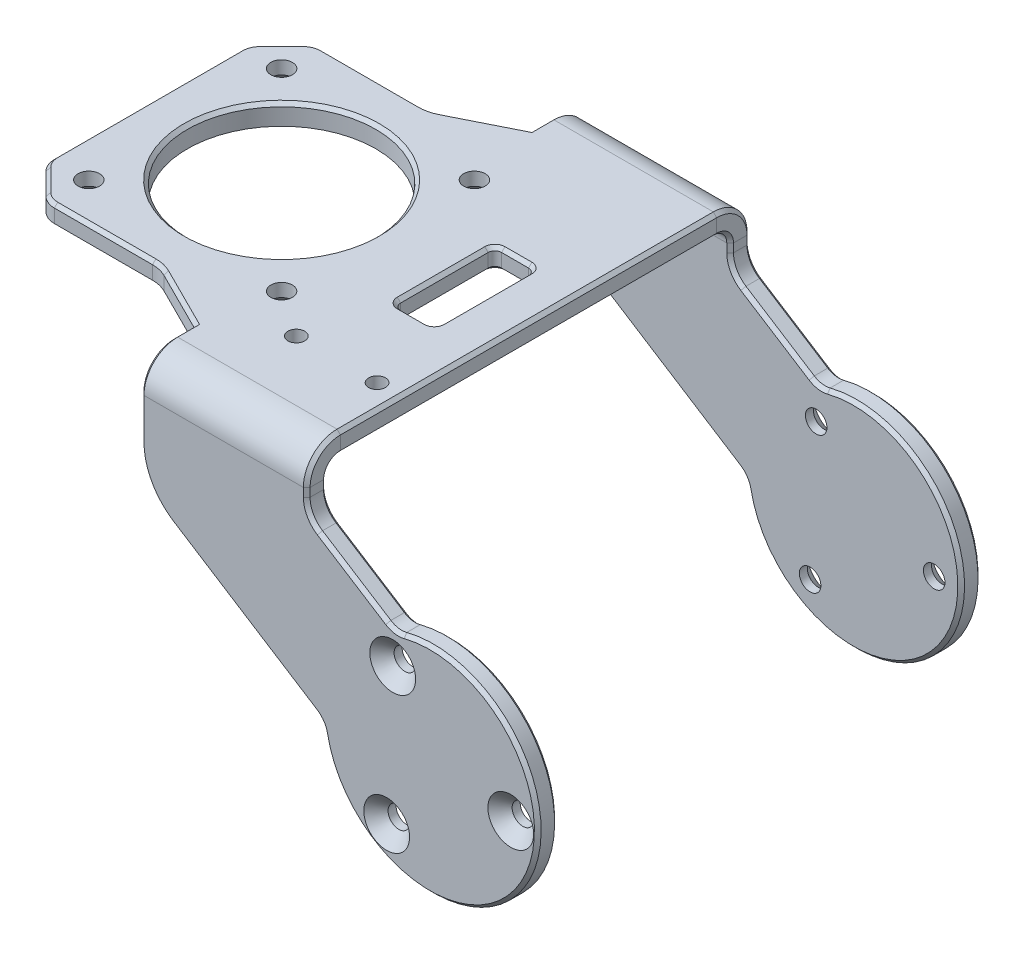
from build123d import *

# Parameters (mm, degrees)
SKETCH_1_R                     = 1.6
SKETCH_1_R_2                   = 14
SKETCH_1_R_3                   = 7
SM_BASE_FLANGE_1_DEPTH         = 3
OTHER_START                    = 32.948163932
OTHER_5_OUTLINE_W              = 24.67856091
OTHER_5_OUTLINE_H              = 3
OTHER_5_DEPTH                  = 29.170252075
OTHER_START_2                  = 29.948163932
OTHER_5_2_OUTLINE_R            = 1.6
OTHER_5_2_OUTLINE_R_2          = 7
OTHER_5_2_DEPTH                = 2.5137
OTHER_START_3                  = 32.631303932
OTHER_5_3_OUTLINE_W            = 24.67856091
OTHER_5_3_OUTLINE_H            = 3
OTHER_5_3_DEPTH                = 0.31686
OTHER_START_4                  = 27.948163932
OTHER_5_4_OUTLINE_R            = 1.6
OTHER_5_4_OUTLINE_R_2          = 7
OTHER_5_4_DEPTH                = 5
OTHER_START_5                  = 12
OTHER_5_5_DEPTH                = 60
OTHER_START_6                  = -62.118416007
OTHER_6_OUTLINE_W              = 24.67856091
OTHER_6_OUTLINE_H              = 3
OTHER_6_DEPTH                  = 29.170252075
OTHER_START_7                  = -32.461863932
OTHER_6_2_OUTLINE_R            = 1.6
OTHER_6_2_OUTLINE_R_2          = 7
OTHER_6_2_DEPTH                = 2.5137
OTHER_START_8                  = -32.948163932
OTHER_6_3_OUTLINE_R            = 1.6
OTHER_6_3_OUTLINE_R_2          = 7
OTHER_6_3_DEPTH                = 5
OTHER_6_4_DEPTH                = 60
OTHER_START_9                  = -3
OTHER_6_5_OUTLINE_R            = 1.6
OTHER_6_5_OUTLINE_R_2          = 7
OTHER_6_5_DEPTH                = 3
CHAMFER_1_SIZE                 = 5
FILLET_1_R                     = 3
SKETCH_14_W                    = 6
SKETCH_14_H                    = 7.5
CUT_EXTRUDE_1_DEPTH            = 10
EXTRUDE_1_DEPTH                = 3
FILLET_5_R                     = 5
SKETCH_16_R                    = 1
CUT_EXTRUDE_2_DEPTH            = 5
HOLE_WIZARD_M3_3_D             = 2.5
HOLE_WIZARD_M3_3_DEPTH         = 3
HOLE_WIZARD_M3_3_TIP           = 0.751075774
FILLET_7_R                     = 4
FILLET_8_R                     = 10
HOLE_WIZARD_M3_2_D             = 3.2
HOLE_WIZARD_M3_2_DEPTH         = 3
HOLE_WIZARD_M3_2_CSINK_D       = 6.8
HOLE_WIZARD_M3_2_CSINK_ANGLE   = 90
HOLE_WIZARD_M3_2_TIP           = 0.96137699
EXTRUDE_START                  = -3
SKETCH_31_R                    = 1.6
SKETCH_31_R_2                  = 1.55
EXTRUDE_2_DEPTH                = 3
FILLET_9_R                     = 3
FILLET_10_R                    = 1
HOLE_WIZARD_M3_3_2_D           = 3.2
HOLE_WIZARD_M3_3_2_DEPTH       = 3
HOLE_WIZARD_M3_3_2_CSINK_D     = 6.8
HOLE_WIZARD_M3_3_2_CSINK_ANGLE = 90
HOLE_WIZARD_M3_3_2_TIP         = 0.96137699
HOLE_WIZARD_M3_4_D             = 3.2
HOLE_WIZARD_M3_4_CSINK_D       = 5.3
HOLE_WIZARD_M3_4_CSINK_ANGLE   = 90
SKETCH_40_R                    = 7
EXTRUDE_3_DEPTH                = 3
SKETCH_41_R                    = 7
EXTRUDE_4_DEPTH                = 3
SKETCH_43_R                    = 17.4
SKETCH_43_R_2                  = 15
CUT_EXTRUDE_4_DEPTH            = 1.9
EXTRUDE_5_DEPTH                = 1.9
FILLET_11_R                    = 1
CHAMFER_4_SIZE                 = 0.5
CHAMFER_5_SIZE                 = 0.5


with BuildPart() as part:
    # 基体-法兰1: sheet metal written as solids
    # Sketch 1 → 基体-法兰1 (new body)
    with BuildSketch(Plane(origin=(0, 0, 0), x_dir=(1, 0, 0), z_dir=(0, 1, 0))):
        with BuildLine():
            Line((12, 20), (-20, 20))
            Line((-20, 20), (-20, -20))
            Line((-20, -20), (12, -20))
            Line((12, -20), (12, -44.485))
            Line((12, -44.485), (39.093770546, -61.729700713))
            ThreePointArc((39.093770546, -61.729700713), (68.497859333, -68.591146222), (49.832703324, -44.857376546))
            Line((49.832703324, -44.857376546), (36.67856091, -36.485))
            Line((36.67856091, -36.485), (36.67856091, 36.485))
            Line((36.67856091, 36.485), (49.832703324, 44.857376546))
            ThreePointArc((49.832703324, 44.857376546), (68.497859333, 68.591146222), (39.093770546, 61.729700713))
            Line((39.093770546, 61.729700713), (12, 44.485))
            Line((12, 44.485), (12, 20))
        make_face()
        with Locations(Location((-14.318912319, -14.318912319, 0), (0, 0, 270))):
            Circle(SKETCH_1_R, mode=Mode.SUBTRACT)
        with Locations(Location((0, 0, 0), (0, 0, 270))):
            Circle(SKETCH_1_R_2, mode=Mode.SUBTRACT)
        with Locations(Location((14.318912319, -14.318912319, 0), (0, 0, 270))):
            Circle(SKETCH_1_R, mode=Mode.SUBTRACT)
        with Locations(Location((48.556640333, -70.1233945, 0), (0, 0, 270))):
            Circle(SKETCH_1_R, mode=Mode.SUBTRACT)
        with Locations(Location((55, -60, 0), (0, 0, 270))):
            Circle(SKETCH_1_R_3, mode=Mode.SUBTRACT)
        with Locations(Location((66.988796643, -60.518415907, 0), (0, 0, 270))):
            Circle(SKETCH_1_R, mode=Mode.SUBTRACT)
        with Locations(Location((49.454563024, -49.358189593, 0), (0, 0, 270))):
            Circle(SKETCH_1_R, mode=Mode.SUBTRACT)
        with Locations(Location((-14.318912319, 14.318912319, 0), (0, 0, 270))):
            Circle(SKETCH_1_R, mode=Mode.SUBTRACT)
        with Locations(Location((14.318912319, 14.318912319, 0), (0, 0, 270))):
            Circle(SKETCH_1_R, mode=Mode.SUBTRACT)
        with Locations(Location((49.454563024, 49.358189593, 0), (0, 0, 90))):
            Circle(SKETCH_1_R, mode=Mode.SUBTRACT)
        with Locations(Location((55, 60, 0), (0, 0, 90))):
            Circle(SKETCH_1_R_3, mode=Mode.SUBTRACT)
        with Locations(Location((48.556640333, 70.1233945, 0), (0, 0, 90))):
            Circle(SKETCH_1_R, mode=Mode.SUBTRACT)
        with Locations(Location((66.988796643, 60.518415907, 0), (0, 0, 90))):
            Circle(SKETCH_1_R, mode=Mode.SUBTRACT)
    extrude(amount=-SM_BASE_FLANGE_1_DEPTH)

    # Other 5: read off the stored shape, not the designer's step
    # Other 5 outline → Other 5 (cut)
    with BuildSketch(Plane.XY.offset(OTHER_START)):
        with Locations((24.339280455, -1.5)):
            Rectangle(OTHER_5_OUTLINE_W, OTHER_5_OUTLINE_H)
    extrude(amount=OTHER_5_DEPTH, mode=Mode.SUBTRACT)

    # Other 5 2 outline → Other 5 2 (add)
    with BuildSketch(Plane.XY.offset(OTHER_START_2)):
        with BuildLine():
            Line((12, -3), (12, -16.463163932))
            Line((12, -16.463163932), (39.093770546, -33.707864645))
            ThreePointArc((39.093770546, -33.707864645), (68.497859333, -40.569310155), (49.832703324, -16.835540479))
            Line((49.832703324, -16.835540479), (36.67856091, -8.463163932))
            Line((36.67856091, -8.463163932), (36.67856091, -3))
            Line((36.67856091, -3), (12, -3))
        make_face()
        with Locations((48.556640333, -42.101558432)):
            Circle(OTHER_5_2_OUTLINE_R, mode=Mode.SUBTRACT)
        with Locations((55, -31.978163932)):
            Circle(OTHER_5_2_OUTLINE_R_2, mode=Mode.SUBTRACT)
        with Locations((66.988796643, -32.496579839)):
            Circle(OTHER_5_2_OUTLINE_R, mode=Mode.SUBTRACT)
        with Locations((49.454563024, -21.336353525)):
            Circle(OTHER_5_2_OUTLINE_R, mode=Mode.SUBTRACT)
    extrude(amount=OTHER_5_2_DEPTH)

    # Other 5 3 outline → Other 5 3 (cut)
    with BuildSketch(Plane.XY.offset(OTHER_START_3)):
        with Locations((24.339280455, -1.5)):
            Rectangle(OTHER_5_3_OUTLINE_W, OTHER_5_3_OUTLINE_H)
    extrude(amount=OTHER_5_3_DEPTH, mode=Mode.SUBTRACT)

    # Other 5 4 outline → Other 5 4 (add)
    with BuildSketch(Plane.XY.offset(OTHER_START_4)):
        with BuildLine():
            Line((12, -3), (12, -16.463163932))
            Line((12, -16.463163932), (39.093770546, -33.707864645))
            ThreePointArc((39.093770546, -33.707864645), (68.497859333, -40.569310155), (49.832703324, -16.835540479))
            Line((49.832703324, -16.835540479), (36.67856091, -8.463163932))
            Line((36.67856091, -8.463163932), (36.67856091, -3))
            Line((36.67856091, -3), (12, -3))
        make_face()
        with Locations((48.556640333, -42.101558432)):
            Circle(OTHER_5_4_OUTLINE_R, mode=Mode.SUBTRACT)
        with Locations((55, -31.978163932)):
            Circle(OTHER_5_4_OUTLINE_R_2, mode=Mode.SUBTRACT)
        with Locations((66.988796643, -32.496579839)):
            Circle(OTHER_5_4_OUTLINE_R, mode=Mode.SUBTRACT)
        with Locations((49.454563024, -21.336353525)):
            Circle(OTHER_5_4_OUTLINE_R, mode=Mode.SUBTRACT)
    extrude(amount=OTHER_5_4_DEPTH)

    # Other 5 5 outline → Other 5 5 (cut)
    with BuildSketch(Plane.YZ.offset(OTHER_START_5)):
        with BuildLine():
            Line((-5, 29.948163932), (-49, 29.948163932))
            Line((-49, 29.948163932), (-49, 27.948163932))
            Line((-49, 27.948163932), (-3, 27.948163932))
            ThreePointArc((-3, 27.948163932), (-3.585786437, 29.362377495), (-5, 29.948163932))
        make_face()
        with BuildLine():
            Line((-49, 77), (-49, 32.94816393))
            Line((-49, 32.94816393), (-5, 32.948163932))
            ThreePointArc((-5, 32.948163932), (-1.464466094, 31.483697838), (0, 27.948163932))
            Line((0, 27.948163932), (0, 77))
            Line((0, 77), (-49, 77))
        make_face()
    extrude(amount=OTHER_5_5_DEPTH, mode=Mode.SUBTRACT)

    # Other 6: read off the stored shape, not the designer's step
    # Other 6 outline → Other 6 (cut)
    with BuildSketch(Plane.XY.offset(OTHER_START_6)):
        with Locations((24.339280455, -1.5)):
            Rectangle(OTHER_6_OUTLINE_W, OTHER_6_OUTLINE_H)
    extrude(amount=OTHER_6_DEPTH, mode=Mode.SUBTRACT)

    # Other 6 2 outline → Other 6 2 (add)
    with BuildSketch(Plane.XY.offset(OTHER_START_7)):
        with BuildLine():
            Line((36.67856091, -8.463163932), (36.67856091, -3))
            Line((36.67856091, -3), (12, -3))
            Line((12, -3), (12, -16.463163932))
            Line((12, -16.463163932), (39.093770546, -33.707864645))
            ThreePointArc((39.093770546, -33.707864645), (68.497859333, -40.569310155), (49.832703324, -16.835540479))
            Line((49.832703324, -16.835540479), (36.67856091, -8.463163932))
        make_face()
        with Locations((48.556640333, -42.101558432)):
            Circle(OTHER_6_2_OUTLINE_R, mode=Mode.SUBTRACT)
        with Locations((55, -31.978163932)):
            Circle(OTHER_6_2_OUTLINE_R_2, mode=Mode.SUBTRACT)
        with Locations((66.988796643, -32.496579839)):
            Circle(OTHER_6_2_OUTLINE_R, mode=Mode.SUBTRACT)
        with Locations((49.454563024, -21.336353525)):
            Circle(OTHER_6_2_OUTLINE_R, mode=Mode.SUBTRACT)
    extrude(amount=OTHER_6_2_DEPTH)

    # Other 6 3 outline → Other 6 3 (add)
    with BuildSketch(Plane.XY.offset(OTHER_START_8)):
        with BuildLine():
            Line((36.67856091, -8.463163932), (36.67856091, -3))
            Line((36.67856091, -3), (12, -3))
            Line((12, -3), (12, -16.463163932))
            Line((12, -16.463163932), (39.093770546, -33.707864645))
            ThreePointArc((39.093770546, -33.707864645), (68.497859333, -40.569310155), (49.832703324, -16.835540479))
            Line((49.832703324, -16.835540479), (36.67856091, -8.463163932))
        make_face()
        with Locations((48.556640333, -42.101558432)):
            Circle(OTHER_6_3_OUTLINE_R, mode=Mode.SUBTRACT)
        with Locations((55, -31.978163932)):
            Circle(OTHER_6_3_OUTLINE_R_2, mode=Mode.SUBTRACT)
        with Locations((66.988796643, -32.496579839)):
            Circle(OTHER_6_3_OUTLINE_R, mode=Mode.SUBTRACT)
        with Locations((49.454563024, -21.336353525)):
            Circle(OTHER_6_3_OUTLINE_R, mode=Mode.SUBTRACT)
    extrude(amount=OTHER_6_3_DEPTH)

    # Other 6 4 outline → Other 6 4 (cut)
    with BuildSketch(Plane.YZ.offset(OTHER_START_5)):
        with BuildLine():
            Line((-49, -29.948163932), (-5, -29.948163932))
            ThreePointArc((-5, -29.948163932), (-3.585786437, -29.362377495), (-3, -27.948163932))
            Line((-3, -27.948163932), (-49, -27.948163932))
            Line((-49, -27.948163932), (-49, -29.948163932))
        make_face()
        with BuildLine():
            Line((-5, -32.948163932), (-49, -32.94816393))
            Line((-49, -32.94816393), (-49, -34))
            Line((-49, -34), (1, -34))
            Line((1, -34), (1, -26))
            Line((1, -26), (0, -26))
            Line((0, -26), (0, -27.948163932))
            ThreePointArc((0, -27.948163932), (-1.464466094, -31.483697838), (-5, -32.948163932))
        make_face()
    extrude(amount=OTHER_6_4_DEPTH, mode=Mode.SUBTRACT)

    # Other 6 5 outline → Other 6 5 (cut)
    with BuildSketch(Plane(origin=(0, 0, 0), x_dir=(1, 0, 0), z_dir=(0, 1, 0)).offset(OTHER_START_9)):
        with BuildLine():
            Line((39.093770546, 61.729700713), (36.67856091, 60.192462946))
            Line((36.67856091, 60.192462946), (36.67856091, 36.485))
            Line((36.67856091, 36.485), (49.832703324, 44.857376546))
            ThreePointArc((49.832703324, 44.857376546), (68.497859333, 68.591146222), (39.093770546, 61.729700713))
        make_face()
        with Locations((49.454563024, 49.358189593)):
            Circle(OTHER_6_5_OUTLINE_R, mode=Mode.SUBTRACT)
        with Locations((48.556640333, 70.1233945)):
            Circle(OTHER_6_5_OUTLINE_R, mode=Mode.SUBTRACT)
        with Locations((55, 60)):
            Circle(OTHER_6_5_OUTLINE_R_2, mode=Mode.SUBTRACT)
        with Locations((66.988796643, 60.518415907)):
            Circle(OTHER_6_5_OUTLINE_R, mode=Mode.SUBTRACT)
    extrude(amount=OTHER_6_5_DEPTH, mode=Mode.SUBTRACT)

    # 倒角1
    chamfer_1_edges = [part.edges().sort_by_distance(p)[0] for p in [
        (-20, -1.5, -20),
        (-20, -1.5, 20),
    ]]
    chamfer(chamfer_1_edges, length=CHAMFER_1_SIZE)

    # 圆角1
    fillet_1_edges = [part.edges().sort_by_distance(p)[0] for p in [
        (-15, -1.5, -20),
        (-20, -1.5, 15),
        (-20, -1.5, -15),
        (-15, -1.5, 20),
    ]]
    fillet(fillet_1_edges, radius=FILLET_1_R)

    # 草图14 → 切除-拉伸1 (cut)
    with BuildSketch(Plane(origin=(0, 0, 0), x_dir=(1, 0, 0), z_dir=(0, 1, 0))):
        with Locations((27.17856091, 3.75)):
            Rectangle(SKETCH_14_W, SKETCH_14_H)
        with Locations((27.17856091, -3.75)):
            Rectangle(SKETCH_14_W, SKETCH_14_H)
    extrude(amount=-CUT_EXTRUDE_1_DEPTH, mode=Mode.SUBTRACT)

    # 草图15 → 凸台-拉伸1 (add)
    with BuildSketch(Plane(origin=(0, 0, 0), x_dir=(1, 0, 0), z_dir=(0, 1, 0))):
        Polygon((12, 25), (12, 20), (2, 20), align=None)
        Polygon((2, -20), (12, -25), (12, -20), align=None)
    extrude(amount=-EXTRUDE_1_DEPTH)

    # 圆角5
    fillet_5_edges = [part.edges().sort_by_distance(p)[0] for p in [
        (2, -1.5, -20),
        (2, -1.5, 20),
    ]]
    fillet(fillet_5_edges, radius=FILLET_5_R)

    # 草图16 → 切除-拉伸2 (cut)
    with BuildSketch(Plane(origin=(0, 0, 0), x_dir=(1, 0, 0), z_dir=(0, 1, 0))):
        with Locations(Location((21.17856091, -19, 0), (0, 0, 270))):
            Circle(SKETCH_16_R)
        with Locations(Location((33.17856091, -19, 0), (0, 0, 270))):
            Circle(SKETCH_16_R)
    extrude(amount=-CUT_EXTRUDE_2_DEPTH, mode=Mode.SUBTRACT)

    # Hole Wizard M3 _3
    with Locations(Plane(origin=(0, 0, 0), x_dir=(1, 0, 0), z_dir=(0, 1, 0))):
        with Locations((21.17856091, -19), (33.17856091, -19)):
            Hole(HOLE_WIZARD_M3_3_D / 2, depth=HOLE_WIZARD_M3_3_DEPTH)
            with Locations((0, 0, -(HOLE_WIZARD_M3_3_DEPTH + HOLE_WIZARD_M3_3_TIP / 2))):  # 118° drill point
                Cone(0, HOLE_WIZARD_M3_3_D / 2, HOLE_WIZARD_M3_3_TIP, mode=Mode.SUBTRACT)

    # 圆角7
    fillet_7_edges = [part.edges().sort_by_distance(p)[0] for p in [
        (36.67856091, -8.463163932, -31.448163932),
        (36.67856091, -8.463163932, 31.448163932),
    ]]
    fillet(fillet_7_edges, radius=FILLET_7_R)

    # 圆角8
    fillet_8_edges = [part.edges().sort_by_distance(p)[0] for p in [
        (12, -16.463163932, -31.448163932),
        (12, -16.463163932, 31.448163932),
    ]]
    fillet(fillet_8_edges, radius=FILLET_8_R)

    # M3 十字槽半沉头木螺钉的锥形沉头孔2
    with Locations(Plane.XY.offset(32.948163932)):
        with Locations((48.556640333, -42.101558432), (49.454563024, -21.336353525), (66.988796643, -32.496579839)):
            CounterSinkHole(HOLE_WIZARD_M3_2_D / 2, HOLE_WIZARD_M3_2_CSINK_D / 2, depth=HOLE_WIZARD_M3_2_DEPTH, counter_sink_angle=HOLE_WIZARD_M3_2_CSINK_ANGLE)
            with Locations((0, 0, -(HOLE_WIZARD_M3_2_DEPTH + HOLE_WIZARD_M3_2_TIP / 2))):  # 118° drill point
                Cone(0, HOLE_WIZARD_M3_2_D / 2, HOLE_WIZARD_M3_2_TIP, mode=Mode.SUBTRACT)

    # 草图31 → 凸台-拉伸2 (add)
    # profile 1 of 4: a face of its own
    with BuildSketch(Plane.XZ.offset(3).offset(EXTRUDE_START)):
        with Locations((14.318912319, 14.318912319)):
            Circle(SKETCH_31_R)
        with Locations(Location((14.318912319, 14.318912319, 0), (0, 0, 270))):
            Circle(SKETCH_31_R_2, mode=Mode.SUBTRACT)
    # profile 2 of 4: a face of its own
    with BuildSketch(Plane.XZ.offset(3).offset(EXTRUDE_START)):
        with Locations((14.318912319, -14.318912319)):
            Circle(SKETCH_31_R)
        with Locations(Location((14.318912319, -14.318912319, 0), (0, 0, 270))):
            Circle(SKETCH_31_R_2, mode=Mode.SUBTRACT)
    # profile 3 of 4: a face of its own
    with BuildSketch(Plane.XZ.offset(3).offset(EXTRUDE_START)):
        with Locations((-14.318912319, -14.318912319)):
            Circle(SKETCH_31_R)
        with Locations(Location((-14.318912319, -14.318912319, 0), (0, 0, 270))):
            Circle(SKETCH_31_R_2, mode=Mode.SUBTRACT)
    # profile 4 of 4: a face of its own
    with BuildSketch(Plane.XZ.offset(3).offset(EXTRUDE_START)):
        with Locations((-14.318912319, 14.318912319)):
            Circle(SKETCH_31_R)
        with Locations(Location((-14.318912319, 14.318912319, 0), (0, 0, 270))):
            Circle(SKETCH_31_R_2, mode=Mode.SUBTRACT)
    extrude(amount=EXTRUDE_2_DEPTH)

    # 圆角9
    fillet_9_edges = [part.edges().sort_by_distance(p)[0] for p in [
        (49.832703324, -16.835540479, -31.448163932),
        (39.093770546, -33.707864645, -31.448163932),
        (39.093770546, -33.707864645, 31.448163932),
        (49.832703324, -16.835540479, 31.448163932),
    ]]
    fillet(fillet_9_edges, radius=FILLET_9_R)

    # 圆角10
    fillet_10_edges = [part.edges().sort_by_distance(p)[0] for p in [
        (30.17856091, -1.5, -7.5),
        (30.17856091, -1.5, 7.5),
        (24.17856091, -1.5, 7.5),
        (24.17856091, -1.5, -7.5),
    ]]
    fillet(fillet_10_edges, radius=FILLET_10_R)

    # Hole Wizard M3 _3 2
    with Locations(Plane(origin=(0, 0, -32.948163932), x_dir=(-1, 0, 0), z_dir=(0, 0, -1))):
        with Locations((-49.454563024, -21.336353525), (-48.556640333, -42.101558432), (-66.988796643, -32.496579839)):
            CounterSinkHole(HOLE_WIZARD_M3_3_2_D / 2, HOLE_WIZARD_M3_3_2_CSINK_D / 2, depth=HOLE_WIZARD_M3_3_2_DEPTH, counter_sink_angle=HOLE_WIZARD_M3_3_2_CSINK_ANGLE)
            with Locations((0, 0, -(HOLE_WIZARD_M3_3_2_DEPTH + HOLE_WIZARD_M3_3_2_TIP / 2))):  # 118° drill point
                Cone(0, HOLE_WIZARD_M3_3_2_D / 2, HOLE_WIZARD_M3_3_2_TIP, mode=Mode.SUBTRACT)

    # Hole Wizard M3 _4 (through all)
    with Locations(Plane.XZ.offset(3)):
        with Locations((-14.318912319, 14.318912319), (-14.318912319, -14.318912319), (14.318912319, -14.318912319), (14.318912319, 14.318912319)):
            CounterSinkHole(HOLE_WIZARD_M3_4_D / 2, HOLE_WIZARD_M3_4_CSINK_D / 2, counter_sink_angle=HOLE_WIZARD_M3_4_CSINK_ANGLE)

    # 草图40 → 凸台-拉伸3 (add)
    with BuildSketch(Plane.XY.offset(32.948163932).offset(EXTRUDE_START)):
        with Locations(Location((55, -31.978163932, 0), (0, 0, 270))):
            Circle(SKETCH_40_R)
    extrude(amount=EXTRUDE_3_DEPTH)

    # 草图41 → 凸台-拉伸4 (add)
    with BuildSketch(Plane(origin=(0, 0, -32.948163932), x_dir=(-1, 0, 0), z_dir=(0, 0, -1))):
        with Locations((-55, -31.978163932)):
            Circle(SKETCH_41_R)
    extrude(amount=-EXTRUDE_4_DEPTH)

    # 草图43 → 切除-拉伸4 (cut)
    with BuildSketch(Plane.XZ.offset(3)):
        with Locations(Location((0, 0, 0), (0, 0, 270))):
            Circle(SKETCH_43_R)
        with Locations(Location((0, 0, 0), (0, 0, 270))):
            Circle(SKETCH_43_R_2, mode=Mode.SUBTRACT)
    extrude(amount=-CUT_EXTRUDE_4_DEPTH, mode=Mode.SUBTRACT)

    # 草图46 → 凸台-拉伸5 (add)
    with BuildSketch(Plane.XZ.offset(3)):
        with BuildLine():
            ThreePointArc((1.567926949, -14.917828431), (-15, 0), (1.567926949, 14.917828431))
            Line((1.567926949, 14.917828431), (1.818795261, 17.304680979))
            ThreePointArc((1.818795261, 17.304680979), (-17.4, 0), (1.818795261, -17.304680979))
            Line((1.818795261, -17.304680979), (1.567926949, -14.917828431))
        make_face()
    extrude(amount=-EXTRUDE_5_DEPTH)

    # 圆角11
    fillet_11_edges = [part.edges().sort_by_distance(p)[0] for p in [
        (1.567926949, -2.05, 14.917828431),
        (1.567926949, -2.05, -14.917828431),
        (1.818795261, -2.05, -17.304680979),
        (1.818795261, -2.05, 17.304680979),
    ]]
    fillet(fillet_11_edges, radius=FILLET_11_R)

    # 倒角4
    chamfer_4_edges = [part.edges().sort_by_distance(p)[0] for p in [
        (12, -3, 26.474081966),
        (12, 0, 26.474081966),
        (36.67856091, -1.464466094, 31.483697838),
        (12, -1.464466094, 31.483697838),
        (12, -3.585786437, 29.362377495),
        (36.67856091, -3.585786437, 29.362377495),
        (12, 0, -26.474081966),
        (12, -3, -26.474081966),
        (36.67856091, -3, 0),
        (36.67856091, 0, 0),
        (36.67856091, -1.464466094, -31.483697838),
        (12, -1.464466094, -31.483697838),
        (12, -3.585786437, -29.362377495),
        (36.67856091, -3.585786437, -29.362377495),
        (-20, -3, 0),
        (-17.5, -3, -17.5),
        (-6.4688496, -3, -20),
        (-17.5, -3, 17.5),
        (-19.771638598, -3, -14.90540961),
        (-14.90540961, -3, -19.771638598),
        (-19.771638598, -3, 14.90540961),
        (-14.90540961, -3, 19.771638598),
        (-17.5, 0, 17.5),
        (-6.4688496, 0, -20),
        (-17.5, 0, -17.5),
        (-20, 0, 0),
        (-19.771638598, 0, -14.90540961),
        (-14.90540961, 0, -19.771638598),
        (-19.771638598, 0, 14.90540961),
        (-14.90540961, 0, 19.771638598),
        (7.527864045, -3, -22.763932023),
        (7.527864045, 0, -22.763932023),
        (-6.4688496, -3, 20),
        (-6.4688496, 0, 20),
        (7.527864045, 0, 22.763932023),
        (7.527864045, -3, 22.763932023),
        (1.968424715, 0, -20.133755053),
        (1.968424715, -3, -20.133755053),
        (1.968424715, 0, 20.133755053),
        (1.968424715, -3, 20.133755053),
        (36.67856091, -5.633799926, -29.948163932),
        (36.67856091, -5.633799926, -32.948163932),
        (37.172056509, -8.192288629, -32.948163932),
        (37.172056509, -8.192288629, -29.948163932),
        (37.172056509, -8.192288629, 32.948163932),
        (37.172056509, -8.192288629, 29.948163932),
        (12, -7.987126866, 32.948163932),
        (12, -7.987126866, 29.948163932),
        (13.233738999, -15.785975675, 32.948163932),
        (13.233738999, -15.785975675, 29.948163932),
        (12, -7.987126866, -32.948163932),
        (13.233738999, -15.785975675, -32.948163932),
        (12, -7.987126866, -29.948163932),
        (13.233738999, -15.785975675, -29.948163932),
        (68.497859333, -40.569310155, -32.948163932),
        (68.497859333, -40.569310155, -29.948163932),
        (27.285789071, -26.192295477, -29.948163932),
        (27.285789071, -26.192295477, -32.948163932),
        (43.605375832, -12.871957829, -32.948163932),
        (43.605375832, -12.871957829, -29.948163932),
        (27.285789071, -26.192295477, 32.948163932),
        (27.285789071, -26.192295477, 29.948163932),
        (68.497859333, -40.569310155, 32.948163932),
        (68.497859333, -40.569310155, 29.948163932),
        (43.605375832, -12.871957829, 29.948163932),
        (43.605375832, -12.871957829, 32.948163932),
        (38.81406997, -33.822640663, -32.948163932),
        (38.81406997, -33.822640663, -29.948163932),
        (49.818266408, -16.533551204, -32.948163932),
        (49.818266408, -16.533551204, -29.948163932),
        (38.81406997, -33.822640663, 32.948163932),
        (38.81406997, -33.822640663, 29.948163932),
        (49.818266408, -16.533551204, 32.948163932),
        (49.818266408, -16.533551204, 29.948163932),
        (36.67856091, -5.633799926, 29.948163932),
        (36.67856091, -5.633799926, 32.948163932),
    ]]
    chamfer(chamfer_4_edges, length=CHAMFER_4_SIZE)

    # 倒角5
    chamfer_5_edges = [part.edges().sort_by_distance(p)[0] for p in [
        (0, 0, -14),
        (27.17856091, -3, -7.5),
        (27.17856091, 0, -7.5),
        (30.17856091, 0, 0),
        (30.17856091, -3, 0),
        (27.17856091, 0, 7.5),
        (27.17856091, -3, 7.5),
        (24.17856091, 0, 0),
        (24.17856091, -3, 0),
        (29.885667691, 0, -7.207106781),
        (29.885667691, -3, -7.207106781),
        (29.885667691, 0, 7.207106781),
        (29.885667691, -3, 7.207106781),
        (24.471454129, 0, -7.207106781),
        (24.471454129, -3, -7.207106781),
        (24.471454129, 0, 7.207106781),
        (24.471454129, -3, 7.207106781),
    ]]
    chamfer(chamfer_5_edges, length=CHAMFER_5_SIZE)


solid = part.part
